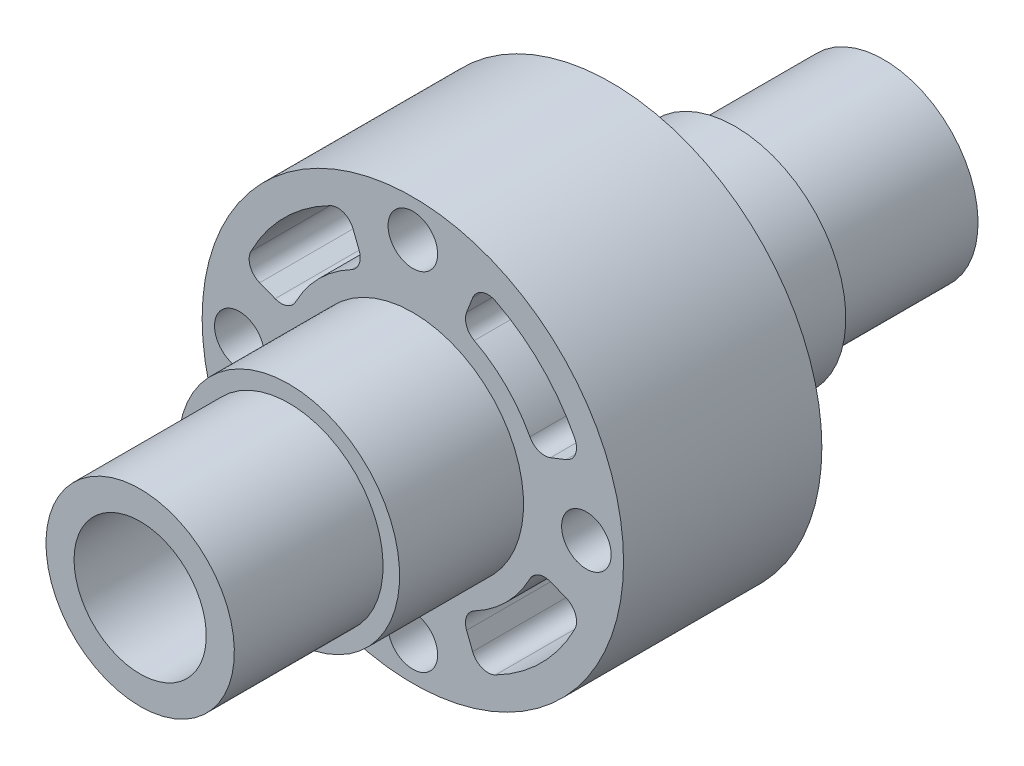
from build123d import *

# Parameters (mm, degrees)
SKETCH_2_R          = 1.5
CUT_EXTRUDE_1_DEPTH = 35.702305399
SKETCH_4_R          = 14
SKETCH_4_R_2        = 12.75
CUT_EXTRUDE_4_DEPTH = 35.702305399
CUT_EXTRUDE_5_DEPTH = 34.724990734
SKETCH_6_R          = 4
CUT_EXTRUDE_6_DEPTH = 49.478087834


with BuildPart() as part:
    # 草图1 → 旋转1 (revolve)
    with BuildSketch(Plane(origin=(0, 0, 0), x_dir=(0, 0, -1), z_dir=(1, 0, 0))):
        Polygon((-22.5, 0), (-22.5, 5.7), (-13.5, 5.7), (-13.5, 6.7), (-11.355493079, 6.7), (-6, 6.7), (-6, 14), (6, 14), (6, 6.7), (11.355493079, 6.7), (13.5, 6.7), (13.5, 5.7), (22.5, 5.7), (22.5, 0), align=None)
    revolve(axis=Axis((0, 0, 22.5), (0, 0, -1)))

    # 草图2 → 切除-拉伸1 (cut, through all)
    with BuildSketch(Plane.XY.offset(6)):
        with Locations((0, 10.5)):
            Circle(SKETCH_2_R)
        with Locations((10.5, 0)):
            Circle(SKETCH_2_R)
        with Locations((0, -10.5)):
            Circle(SKETCH_2_R)
        with Locations((-10.5, 0)):
            Circle(SKETCH_2_R)
    extrude(amount=-CUT_EXTRUDE_1_DEPTH, mode=Mode.SUBTRACT)

    # 草图4 → 切除-拉伸4 (cut, through all)
    with BuildSketch(Plane(origin=(0, 0, -6), x_dir=(-1, 0, 0), z_dir=(0, 0, -1))):
        Circle(SKETCH_4_R)
        Circle(SKETCH_4_R_2, mode=Mode.SUBTRACT)
    extrude(amount=-CUT_EXTRUDE_4_DEPTH, mode=Mode.SUBTRACT)

    # 草图5 → 切除-拉伸5 (cut, through all)
    with BuildSketch(Plane(origin=(0, 0, -6), x_dir=(-1, 0, 0), z_dir=(0, 0, -1))):
        with BuildLine():
            Line((-9.26871571, 3.618136135), (-8.331955809, 3.252462513))
            ThreePointArc((-8.331955809, 3.252462513), (-7.618330669, 3.247249598), (-7.082950618, 3.719114215))
            ThreePointArc((-7.082950618, 3.719114215), (-5.656854249, 5.656854249), (-3.719114215, 7.082950618))
            ThreePointArc((-3.719114215, 7.082950618), (-3.247249598, 7.618330669), (-3.252462513, 8.331955809))
            Line((-3.252462513, 8.331955809), (-3.618136135, 9.26871571))
            ThreePointArc((-3.618136135, 9.26871571), (-4.194460373, 9.839863314), (-5.004644825, 9.795587281))
            ThreePointArc((-5.004644825, 9.795587281), (-7.778174593, 7.778174593), (-9.795587281, 5.004644825))
            ThreePointArc((-9.795587281, 5.004644825), (-9.839863314, 4.194460373), (-9.26871571, 3.618136135))
        make_face()
        with BuildLine():
            Line((3.618136135, 9.26871571), (3.252462513, 8.331955809))
            ThreePointArc((3.252462513, 8.331955809), (3.247249598, 7.618330669), (3.719114215, 7.082950618))
            ThreePointArc((3.719114215, 7.082950618), (5.656854249, 5.656854249), (7.082950618, 3.719114215))
            ThreePointArc((7.082950618, 3.719114215), (7.618330669, 3.247249598), (8.331955809, 3.252462513))
            Line((8.331955809, 3.252462513), (9.26871571, 3.618136135))
            ThreePointArc((9.26871571, 3.618136135), (9.839863314, 4.194460373), (9.795587281, 5.004644825))
            ThreePointArc((9.795587281, 5.004644825), (7.778174593, 7.778174593), (5.004644825, 9.795587281))
            ThreePointArc((5.004644825, 9.795587281), (4.194460373, 9.839863314), (3.618136135, 9.26871571))
        make_face()
        with BuildLine():
            Line((9.26871571, -3.618136135), (8.331955809, -3.252462513))
            ThreePointArc((8.331955809, -3.252462513), (7.618330669, -3.247249598), (7.082950618, -3.719114215))
            ThreePointArc((7.082950618, -3.719114215), (5.656854249, -5.656854249), (3.719114215, -7.082950618))
            ThreePointArc((3.719114215, -7.082950618), (3.247249598, -7.618330669), (3.252462513, -8.331955809))
            Line((3.252462513, -8.331955809), (3.618136135, -9.26871571))
            ThreePointArc((3.618136135, -9.26871571), (4.194460373, -9.839863314), (5.004644825, -9.795587281))
            ThreePointArc((5.004644825, -9.795587281), (7.778174593, -7.778174593), (9.795587281, -5.004644825))
            ThreePointArc((9.795587281, -5.004644825), (9.839863314, -4.194460373), (9.26871571, -3.618136135))
        make_face()
        with BuildLine():
            Line((-3.618136135, -9.26871571), (-3.252462513, -8.331955809))
            ThreePointArc((-3.252462513, -8.331955809), (-3.247249598, -7.618330669), (-3.719114215, -7.082950618))
            ThreePointArc((-3.719114215, -7.082950618), (-5.656854249, -5.656854249), (-7.082950618, -3.719114215))
            ThreePointArc((-7.082950618, -3.719114215), (-7.618330669, -3.247249598), (-8.331955809, -3.252462513))
            Line((-8.331955809, -3.252462513), (-9.26871571, -3.618136135))
            ThreePointArc((-9.26871571, -3.618136135), (-9.839863314, -4.194460373), (-9.795587281, -5.004644825))
            ThreePointArc((-9.795587281, -5.004644825), (-7.778174593, -7.778174593), (-5.004644825, -9.795587281))
            ThreePointArc((-5.004644825, -9.795587281), (-4.194460373, -9.839863314), (-3.618136135, -9.26871571))
        make_face()
    extrude(amount=-CUT_EXTRUDE_5_DEPTH, mode=Mode.SUBTRACT)

    # 草图6 → 切除-拉伸6 (cut, through all)
    with BuildSketch(Plane(origin=(0, 0, -22.5), x_dir=(-1, 0, 0), z_dir=(0, 0, -1))):
        Circle(SKETCH_6_R)
    extrude(amount=-CUT_EXTRUDE_6_DEPTH, mode=Mode.SUBTRACT)


solid = part.part
